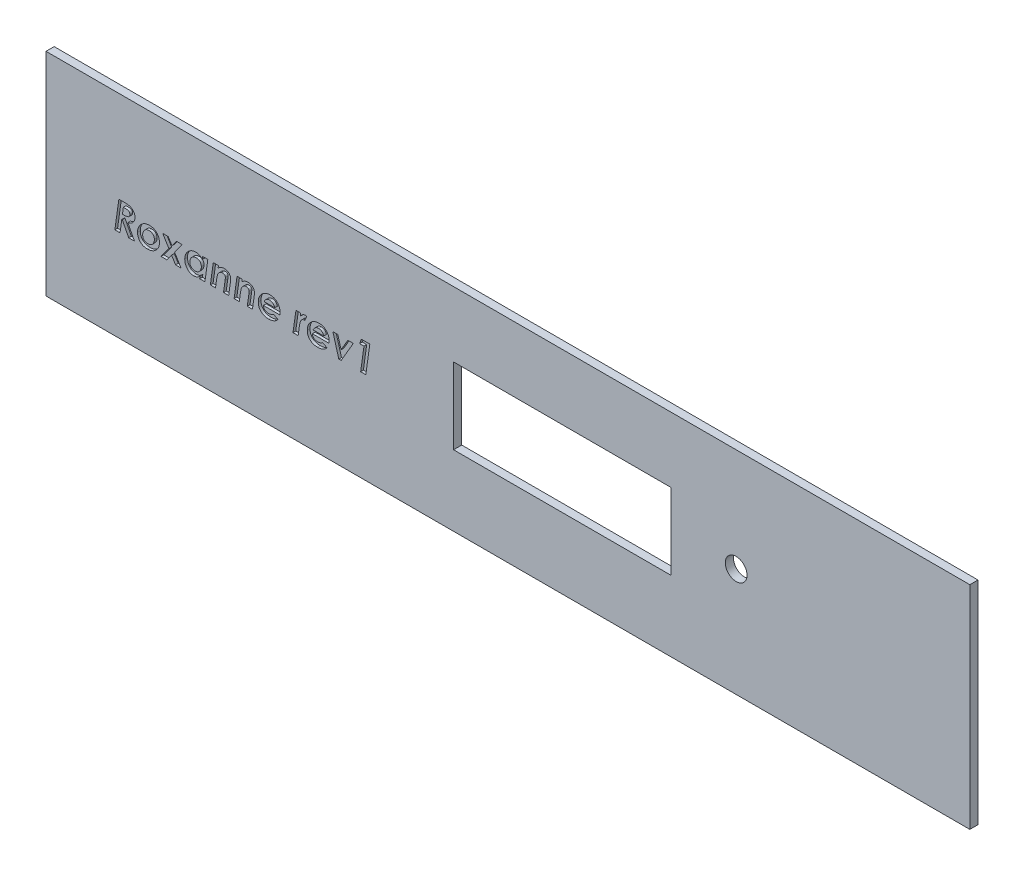
from build123d import *

# Parameters (mm, degrees)
ESQUISSE1_W             = 340
ESQUISSE1_H             = 78
BOSS_EXTRU_1_DEPTH      = 3
ENL_V_MAT_EXTRU_2_DEPTH = 1
ESQUISSE4_R             = 4
ESQUISSE4_W             = 80
ESQUISSE4_H             = 28
ENL_V_MAT_EXTRU_3_DEPTH = 175.441967547


with BuildPart() as part:
    # Esquisse1 → Boss.-Extru.1 (new body)
    with BuildSketch(Plane.XY):
        Rectangle(ESQUISSE1_W, ESQUISSE1_H)
    extrude(amount=BOSS_EXTRU_1_DEPTH)

    # Esquisse3 → Enlèv. mat.-Extru.2 (cut)
    # profile 1 of 11: a face of its own
    with BuildSketch(Plane.XY.offset(3)):
        with BuildLine():
            Line((-143.18360553, 5.280285758), (-141.359987741, 5.280285758))
            add(Edge.make_bspline(
                [(-141.359987741, 5.280285758), (-141.224655587, 5.279732714), (-140.963718923, 5.278666378), (-140.588483514, 5.263503099), (-140.244081244, 5.240626382), (-139.930921624, 5.210436022), (-139.648743197, 5.168548587), (-139.39813277, 5.118254331), (-139.177489639, 5.062244668), (-139.045170732, 5.010196837), (-138.983184857, 4.985814604)],
                knots=[0, 0, 0, 0, 1.348808202, 2.600664361, 3.742342956, 4.788858012, 5.735658768, 6.584006912, 7.336666444, 8, 8, 8, 8], degree=3))
            add(Edge.make_bspline(
                [(-138.983184857, 4.985814604), (-138.913396732, 4.954343493), (-138.776971993, 4.892822453), (-138.581483293, 4.788540514), (-138.398423342, 4.676200564), (-138.230826029, 4.551567019), (-138.075154533, 4.419887795), (-137.932374156, 4.27991045), (-137.803634581, 4.129486764), (-137.687584711, 3.971314785), (-137.58439367, 3.805599086), (-137.495814793, 3.631522477), (-137.419222171, 3.450558736), (-137.359409683, 3.260738661), (-137.309698315, 3.064340828), (-137.277546805, 2.860126101), (-137.254920089, 2.648783332), (-137.253060866, 2.505309215), (-137.252115145, 2.432329027)],
                knots=[0, 0, 0, 0, 1.116361014, 2.182309107, 3.229450697, 4.24598407, 5.225421932, 6.201651319, 7.158895679, 8.110002388, 9.060669178, 10.002827475, 10.956240434, 11.923213192, 12.902917952, 13.908279153, 14.936015885, 16, 16, 16, 16], degree=3))
            add(Edge.make_bspline(
                [(-137.252115145, 2.432329027), (-137.254339243, 2.342521883), (-137.258729972, 2.16522804), (-137.287419918, 1.903784419), (-137.340930232, 1.652902122), (-137.412992487, 1.411790847), (-137.502271834, 1.178889427), (-137.617409234, 0.958250518), (-137.75049375, 0.746029759), (-137.904192784, 0.5450095), (-138.07598846, 0.353345707), (-138.274352276, 0.182318009), (-138.488310465, 0.020424308), (-138.72665273, -0.121481136), (-138.982824071, -0.253298657), (-139.262667394, -0.364982473), (-139.560930477, -0.468049396), (-139.770067112, -0.519632956), (-139.877115145, -0.546036358)],
                knots=[0, 0, 0, 0, 0.995453645, 1.965186658, 2.910129054, 3.83459069, 4.752398018, 5.669942118, 6.588407184, 7.525617038, 8.471772905, 9.435289717, 10.423772802, 11.441988612, 12.505459691, 13.613754905, 14.778583949, 16, 16, 16, 16], degree=3))
            Line((-139.877115145, -0.546036358), (-137.454038222, -5.219714242))
            Line((-137.454038222, -5.219714242), (-139.559506972, -5.219714242))
            Line((-139.559506972, -5.219714242), (-141.932103126, -0.642791165))
            Line((-141.932103126, -0.642791165), (-142.110889184, -0.642791165))
            Line((-142.110889184, -0.642791165), (-142.754518991, -5.219714242))
            Line((-142.754518991, -5.219714242), (-144.655961299, -5.219714242))
            Line((-144.655961299, -5.219714242), (-143.18360553, 5.280285758))
        make_face()
        with BuildLine():
            add(Edge.make_bspline(
                [(-141.864795434, 1.107208835), (-141.729459211, 1.108465504), (-141.470595066, 1.110869196), (-141.100885896, 1.127588623), (-140.767493515, 1.153999243), (-140.47137943, 1.191741744), (-140.211764702, 1.236377465), (-139.989752185, 1.292101975), (-139.804324277, 1.358357402), (-139.652556306, 1.436929723), (-139.529613798, 1.529181293), (-139.423201774, 1.627628176), (-139.33459462, 1.737828565), (-139.261485776, 1.857932422), (-139.205099334, 1.988188689), (-139.164435992, 2.129479833), (-139.141952908, 2.280863782), (-139.138496615, 2.385283221), (-139.13673053, 2.438639123)],
                knots=[0, 0, 0, 0, 1.892208387, 3.619318591, 5.173427176, 6.566868293, 7.791773198, 8.8545744, 9.763297566, 10.539470204, 11.233547833, 11.906251103, 12.5615143, 13.203742025, 13.866659999, 14.539934446, 15.25394049, 16, 16, 16, 16], degree=3))
            add(Edge.make_bspline(
                [(-139.13673053, 2.438639123), (-139.139016658, 2.499137012), (-139.143451434, 2.616494624), (-139.181810435, 2.785523428), (-139.247403006, 2.938855511), (-139.339584426, 3.075024949), (-139.454621882, 3.195092419), (-139.594961274, 3.29398183), (-139.758998988, 3.371826823), (-139.912663197, 3.423256651), (-140.058114425, 3.453046124), (-140.193702995, 3.47306066), (-140.354236076, 3.492373974), (-140.540196541, 3.50665556), (-140.751360843, 3.516102563), (-140.987621471, 3.525282359), (-141.248501794, 3.528546747), (-141.430801515, 3.529688541), (-141.526153607, 3.530285758)],
                knots=[0, 0, 0, 0, 0.974340854, 1.890087692, 2.776057671, 3.647490651, 4.526730822, 5.442477659, 6.397820337, 7.445016909, 8.045730266, 8.789007992, 9.653967296, 10.651691253, 11.794598421, 13.061237498, 14.462876682, 16, 16, 16, 16], degree=3))
            Line((-141.526153607, 3.530285758), (-141.864795434, 1.107208835))
        make_face(mode=Mode.SUBTRACT)
    # profile 2 of 11: a face of its own
    with BuildSketch(Plane.XY.offset(3)):
        with BuildLine():
            add(Edge.make_bspline(
                [(-131.884326684, 2.587978065), (-131.799424296, 2.587195482), (-131.631391108, 2.585646646), (-131.38228626, 2.56022345), (-131.138357118, 2.525748631), (-130.900775398, 2.475336872), (-130.66975107, 2.409470777), (-130.44430611, 2.329236173), (-130.223883352, 2.235440947), (-130.011532567, 2.12538596), (-129.807440575, 2.003756871), (-129.613477722, 1.869615222), (-129.432874264, 1.721026436), (-129.260565884, 1.563786358), (-129.103811525, 1.39076428), (-128.958349948, 1.206885736), (-128.822422839, 1.012254695), (-128.699232084, 0.805672087), (-128.590746763, 0.588402819), (-128.49277852, 0.366022365), (-128.412731147, 0.135103632), (-128.348982744, -0.102150197), (-128.294065883, -0.34520142), (-128.260905523, -0.595152736), (-128.23508406, -0.851189781), (-128.233624584, -1.024130633), (-128.232884376, -1.111841646)],
                knots=[0, 0, 0, 0, 1.048380346, 2.074885017, 3.090367486, 4.090964834, 5.072523792, 6.056029873, 7.045505985, 8.029469653, 9.008388104, 9.979110116, 10.939576094, 11.895736256, 12.858269977, 13.820062943, 14.790784955, 15.789017664, 16.788414625, 17.789274365, 18.789121639, 19.804049856, 20.823403653, 21.864603227, 22.916983403, 24, 24, 24, 24], degree=3))
            add(Edge.make_bspline(
                [(-128.232884376, -1.111841646), (-128.23718252, -1.256460176), (-128.245648086, -1.541298868), (-128.305004328, -1.960318696), (-128.406448381, -2.362010406), (-128.548465447, -2.747536071), (-128.730127475, -3.116996391), (-128.952188571, -3.470722462), (-129.217240586, -3.805028485), (-129.516085384, -4.120689545), (-129.844008707, -4.409860524), (-130.195628193, -4.662799459), (-130.566429681, -4.876622764), (-130.955488694, -5.053039351), (-131.365641168, -5.187139972), (-131.793845842, -5.283186733), (-132.24082176, -5.344642916), (-132.545280345, -5.351059656), (-132.700432453, -5.354329627)],
                knots=[0, 0, 0, 0, 1.011104245, 1.991457176, 2.952197104, 3.902991464, 4.858928698, 5.826026836, 6.817568841, 7.837123857, 8.861887107, 9.870051414, 10.860623363, 11.850212162, 12.851715058, 13.872153699, 14.915649431, 16, 16, 16, 16], degree=3))
            add(Edge.make_bspline(
                [(-132.700432453, -5.354329627), (-132.834499501, -5.351862118), (-133.096463555, -5.347040661), (-133.478436129, -5.298932071), (-133.840188255, -5.224898759), (-134.180720648, -5.116248721), (-134.501389394, -4.980495871), (-134.800884768, -4.812307992), (-135.079969367, -4.614823493), (-135.33297425, -4.384525314), (-135.563287126, -4.132666316), (-135.762919062, -3.858639471), (-135.933658765, -3.566057373), (-136.069309328, -3.253296835), (-136.17739275, -2.923081285), (-136.254996946, -2.574530912), (-136.302272159, -2.206898841), (-136.307259756, -1.955435129), (-136.309807453, -1.826985877)],
                knots=[0, 0, 0, 0, 1.130534475, 2.209039425, 3.242686211, 4.241648197, 5.219495055, 6.175504508, 7.134035888, 8.097337106, 9.056251676, 10.008649417, 10.952170628, 11.908308165, 12.879116703, 13.879338768, 14.916752852, 16, 16, 16, 16], degree=3))
            add(Edge.make_bspline(
                [(-136.309807453, -1.826985877), (-136.305653143, -1.671853183), (-136.297480704, -1.366673073), (-136.236372391, -0.918738556), (-136.130506904, -0.491920766), (-135.984275181, -0.085456017), (-135.799606699, 0.30256986), (-135.567153477, 0.667235656), (-135.297450469, 1.014484362), (-134.987058437, 1.334746111), (-134.650968588, 1.626901847), (-134.298198258, 1.885340642), (-133.928364149, 2.100297196), (-133.547659629, 2.281844135), (-133.149676546, 2.417485655), (-132.740165524, 2.517087926), (-132.31664328, 2.577899178), (-132.029658555, 2.584589846), (-131.884326684, 2.587978065)],
                knots=[0, 0, 0, 0, 1.070407058, 2.105725986, 3.11260329, 4.099768105, 5.082273654, 6.071629737, 7.078227986, 8.111679688, 9.144009435, 10.148605521, 11.124500349, 12.092034995, 13.054511379, 14.020338642, 14.997480131, 16, 16, 16, 16], degree=3))
        make_face()
        with BuildLine():
            add(Edge.make_bspline(
                [(-132.023148799, 0.837978065), (-132.11723146, 0.835689933), (-132.300588612, 0.831230606), (-132.567134418, 0.792650658), (-132.816899094, 0.729801551), (-133.050820911, 0.641814014), (-133.265783517, 0.524421438), (-133.466518637, 0.38522868), (-133.647196888, 0.21734191), (-133.810003867, 0.02860714), (-133.953511229, -0.174914403), (-134.079629336, -0.384297742), (-134.186375507, -0.598698987), (-134.271232498, -0.8175758), (-134.342963321, -1.039496848), (-134.390624099, -1.26650027), (-134.418258584, -1.498176147), (-134.422864721, -1.653735048), (-134.425192068, -1.732334435)],
                knots=[0, 0, 0, 0, 1.147646984, 2.236642535, 3.278363253, 4.285788599, 5.277283386, 6.259990092, 7.25913394, 8.278119336, 9.296601724, 10.294389209, 11.258634566, 12.215104854, 13.156804447, 14.101569642, 15.040778374, 16, 16, 16, 16], degree=3))
            add(Edge.make_bspline(
                [(-134.425192068, -1.732334435), (-134.42344343, -1.801100593), (-134.420025192, -1.935524656), (-134.397214465, -2.132121093), (-134.356711492, -2.317737834), (-134.302737462, -2.493725108), (-134.230137949, -2.659138914), (-134.14253735, -2.814616279), (-134.037393555, -2.958623594), (-133.921128711, -3.093800872), (-133.787790124, -3.212928275), (-133.645075637, -3.318292455), (-133.491909883, -3.408460321), (-133.326696407, -3.478995878), (-133.151687582, -3.536587223), (-132.966206316, -3.575926086), (-132.770445967, -3.59934693), (-132.636697295, -3.602637523), (-132.567920434, -3.604329627)],
                knots=[0, 0, 0, 0, 1.110133544, 2.170088686, 3.189065258, 4.17351184, 5.136579884, 6.099647928, 7.048308506, 8.010844321, 8.972448026, 9.927769731, 10.871216919, 11.834284962, 12.822174017, 13.841150589, 14.889866456, 16, 16, 16, 16], degree=3))
            add(Edge.make_bspline(
                [(-132.567920434, -3.604329627), (-132.471058766, -3.601835138), (-132.282260578, -3.596972997), (-132.007991023, -3.561329456), (-131.751774841, -3.500802672), (-131.51368667, -3.414146569), (-131.29397621, -3.301576699), (-131.089941746, -3.167074641), (-130.906206442, -3.005029659), (-130.740762205, -2.82220472), (-130.59538988, -2.623653927), (-130.468480498, -2.415513498), (-130.358465615, -2.201762203), (-130.269704161, -1.979940846), (-130.202552894, -1.751550489), (-130.154012498, -1.51662091), (-130.123885119, -1.274579321), (-130.119641857, -1.11052531), (-130.117499761, -1.027707031)],
                knots=[0, 0, 0, 0, 1.164111062, 2.269030304, 3.317651816, 4.322802953, 5.30652745, 6.278887004, 7.252451034, 8.242831511, 9.237327035, 10.205734188, 11.170614506, 12.123681709, 13.072978069, 14.028315502, 15.004647829, 16, 16, 16, 16], degree=3))
            add(Edge.make_bspline(
                [(-130.117499761, -1.027707031), (-130.11907956, -0.960324798), (-130.122184835, -0.827877386), (-130.147662745, -0.634098734), (-130.190236046, -0.450640179), (-130.246233131, -0.275625388), (-130.323156634, -0.112345981), (-130.413025674, 0.043662363), (-130.524430288, 0.186173601), (-130.647559785, 0.320562261), (-130.783591075, 0.442729819), (-130.932389514, 0.548033747), (-131.089359821, 0.639335994), (-131.258060071, 0.710733805), (-131.435502813, 0.767464063), (-131.622462143, 0.810306833), (-131.819976837, 0.832703739), (-131.95438882, 0.836193062), (-132.023148799, 0.837978065)],
                knots=[0, 0, 0, 0, 1.079193067, 2.121276228, 3.123935011, 4.093589047, 5.058482656, 6.010079462, 6.971567708, 7.949254825, 8.927715837, 9.893916005, 10.864935156, 11.830939453, 12.821955205, 13.846519011, 14.898362312, 16, 16, 16, 16], degree=3))
        make_face(mode=Mode.SUBTRACT)
    # profile 3 of 11: a face of its own
    with BuildSketch(Plane.XY.offset(3)):
        Polygon((-127.046586299, 2.453362681), (-125.018942068, 2.453362681), (-123.658064664, 0.240622296), (-122.027956491, 2.453362681), (-119.88673053, 2.453362681), (-122.684206491, -1.345315204), (-120.303196876, -5.219714242), (-122.332944472, -5.219714242), (-123.790576684, -2.845014723), (-125.540576684, -5.219714242), (-127.681802645, -5.219714242), (-124.764434857, -1.261180588), align=None)
    # profile 4 of 11: a face of its own
    with BuildSketch(Plane.XY.offset(3)):
        with BuildLine():
            Line((-112.335648799, 2.453362681), (-110.434206491, 2.453362681))
            Line((-110.434206491, 2.453362681), (-111.523749761, -5.219714242))
            Line((-111.523749761, -5.219714242), (-113.425192068, -5.219714242))
            Line((-113.425192068, -5.219714242), (-113.292680049, -4.281613281))
            add(Edge.make_bspline(
                [(-113.292680049, -4.281613281), (-113.391549944, -4.37572398), (-113.580077294, -4.55517639), (-113.872072669, -4.787986291), (-114.153152411, -4.977325815), (-114.430265349, -5.122546783), (-114.711023, -5.227906941), (-115.002450313, -5.300882728), (-115.310473081, -5.346523043), (-115.521382516, -5.351683686), (-115.629518991, -5.354329627)],
                knots=[0, 0, 0, 0, 1.236324186, 2.357450916, 3.379388742, 4.30284698, 5.185433758, 6.089881904, 7.020653398, 8, 8, 8, 8], degree=3))
            add(Edge.make_bspline(
                [(-115.629518991, -5.354329627), (-115.753121458, -5.351450138), (-115.995190369, -5.345810811), (-116.348302095, -5.291238656), (-116.682118528, -5.205888972), (-116.996796868, -5.085457959), (-117.290636802, -4.928261271), (-117.566451539, -4.737701234), (-117.821746917, -4.511432029), (-118.053021662, -4.25244662), (-118.261596121, -3.97330981), (-118.443013841, -3.678343798), (-118.600542242, -3.374449876), (-118.723153755, -3.056076226), (-118.824368358, -2.729177072), (-118.89212519, -2.389392546), (-118.935833267, -2.03916224), (-118.94153749, -1.801878218), (-118.944422837, -1.681853665)],
                knots=[0, 0, 0, 0, 1.072254913, 2.099954687, 3.093402483, 4.05863531, 5.017013142, 5.979305845, 6.962352722, 7.970695896, 8.988290287, 9.983079422, 10.973839091, 11.95483031, 12.940586347, 13.940815436, 14.958409826, 16, 16, 16, 16], degree=3))
            add(Edge.make_bspline(
                [(-118.944422837, -1.681853665), (-118.94297508, -1.589238128), (-118.940095048, -1.40499745), (-118.911649867, -1.130181298), (-118.865301965, -0.859107437), (-118.801646915, -0.590876341), (-118.722301664, -0.325561554), (-118.623114652, -0.0641166), (-118.504137139, 0.192932093), (-118.37040087, 0.445892218), (-118.222784501, 0.691712844), (-118.057191986, 0.922436872), (-117.883364696, 1.142280938), (-117.69572687, 1.346934497), (-117.494751404, 1.535729447), (-117.284581212, 1.714619101), (-117.058448717, 1.874936722), (-116.824316735, 2.025055503), (-116.580825276, 2.155767779), (-116.334573148, 2.273231474), (-116.083658241, 2.368988742), (-115.831244811, 2.450047867), (-115.575132578, 2.51091946), (-115.316572064, 2.554674182), (-115.055259357, 2.583711822), (-114.880096032, 2.586554526), (-114.792379568, 2.587978065)],
                knots=[0, 0, 0, 0, 1.010861959, 2.01091412, 3.012605424, 4.011485121, 5.018863341, 6.033918867, 7.061452407, 8.109228878, 9.15680961, 10.18900835, 11.207521355, 12.215190347, 13.216881651, 14.216552911, 15.225616441, 16.240671966, 17.251099115, 18.240697123, 19.217272556, 20.180771028, 21.133199006, 22.08832996, 23.042693801, 24, 24, 24, 24], degree=3))
            add(Edge.make_bspline(
                [(-114.792379568, 2.587978065), (-114.675727844, 2.584654629), (-114.445790553, 2.578103658), (-114.109013759, 2.516693296), (-113.786387893, 2.419565961), (-113.47871156, 2.284875352), (-113.189765949, 2.113249718), (-112.927988774, 1.901842454), (-112.687465106, 1.659521047), (-112.555992929, 1.471811285), (-112.489194472, 1.376439604)],
                knots=[0, 0, 0, 0, 1.030509072, 2.031281277, 3.015697838, 4.003854478, 4.993584726, 5.977161716, 6.972235198, 8, 8, 8, 8], degree=3))
            Line((-112.489194472, 1.376439604), (-112.335648799, 2.453362681))
        make_face()
        with BuildLine():
            add(Edge.make_bspline(
                [(-115.206742549, -3.604329627), (-115.09709637, -3.600940622), (-114.883265861, -3.594331429), (-114.574338042, -3.535784683), (-114.286460304, -3.443588633), (-114.020067642, -3.311794182), (-113.774243939, -3.138457124), (-113.551107591, -2.922119436), (-113.349568342, -2.662961966), (-113.172821846, -2.368792627), (-113.025109527, -2.052416083), (-112.916883097, -1.7257926), (-112.847864189, -1.395191344), (-112.840115261, -1.172465955), (-112.836249761, -1.061360877)],
                knots=[0, 0, 0, 0, 1.017901168, 1.985097214, 2.910041334, 3.818973104, 4.735274743, 5.693545178, 6.695670165, 7.777101795, 8.875856117, 9.932619244, 10.968700869, 12, 12, 12, 12], degree=3))
            add(Edge.make_bspline(
                [(-112.836249761, -1.061360877), (-112.838018066, -0.99189294), (-112.841493174, -0.855373177), (-112.86420903, -0.656014284), (-112.904142036, -0.467162158), (-112.96143901, -0.288933468), (-113.034627289, -0.121136541), (-113.124249288, 0.036720541), (-113.229025285, 0.18353247), (-113.349457176, 0.319173847), (-113.484040152, 0.439346466), (-113.626735494, 0.549517666), (-113.784176997, 0.636029449), (-113.948733014, 0.711521482), (-114.124900323, 0.767206921), (-114.31028141, 0.810594474), (-114.507192734, 0.832647366), (-114.641593883, 0.836173984), (-114.710348318, 0.837978065)],
                knots=[0, 0, 0, 0, 1.109141645, 2.179707075, 3.198451464, 4.18615572, 5.163657463, 6.116161664, 7.079133258, 8.038519567, 9.005387219, 9.956904198, 10.909408399, 11.866440704, 12.843493655, 13.853714903, 14.902043453, 16, 16, 16, 16], degree=3))
            add(Edge.make_bspline(
                [(-114.710348318, 0.837978065), (-114.79041292, 0.836230408), (-114.948470829, 0.832780305), (-115.180735029, 0.797147382), (-115.404754494, 0.743943054), (-115.618360256, 0.664325181), (-115.823781047, 0.56619447), (-116.017822715, 0.442212881), (-116.204257868, 0.29855228), (-116.379128235, 0.133848774), (-116.538631801, -0.048390772), (-116.678231501, -0.244989034), (-116.797029321, -0.454824948), (-116.893829671, -0.677570395), (-116.967119381, -0.914179948), (-117.022265328, -1.161596176), (-117.054026946, -1.423014042), (-117.057849591, -1.601139277), (-117.059807453, -1.692370492)],
                knots=[0, 0, 0, 0, 0.994897251, 1.964056203, 2.915642991, 3.853470011, 4.79324038, 5.741466074, 6.711095529, 7.716481674, 8.723680824, 9.71796663, 10.70964959, 11.717112863, 12.731868792, 13.785363818, 14.865719672, 16, 16, 16, 16], degree=3))
            add(Edge.make_bspline(
                [(-117.059807453, -1.692370492), (-117.058007587, -1.762528871), (-117.0544878, -1.899729407), (-117.032354478, -2.100781367), (-116.989252041, -2.290491505), (-116.932653225, -2.470095354), (-116.861252306, -2.639765869), (-116.772320541, -2.798465806), (-116.666441048, -2.94649149), (-116.545138686, -3.082639766), (-116.410064665, -3.203843604), (-116.26692239, -3.312749622), (-116.112640066, -3.402919547), (-115.949323663, -3.477482755), (-115.77637509, -3.534142757), (-115.594407397, -3.573237249), (-115.403841025, -3.599976324), (-115.273444656, -3.602856381), (-115.206742549, -3.604329627)],
                knots=[0, 0, 0, 0, 1.124431694, 2.198919568, 3.234766021, 4.236791382, 5.213425507, 6.179206721, 7.145706547, 8.12447102, 9.094881178, 10.04988442, 11.001776355, 11.952075609, 12.922030374, 13.911569148, 14.931697721, 16, 16, 16, 16], degree=3))
        make_face(mode=Mode.SUBTRACT)
    # profile 5 of 11: a face of its own
    with BuildSketch(Plane.XY.offset(3)):
        with BuildLine():
            Line((-108.431802645, 2.453362681), (-106.530360337, 2.453362681))
            Line((-106.530360337, 2.453362681), (-106.650252164, 1.605706431))
            add(Edge.make_bspline(
                [(-106.650252164, 1.605706431), (-106.558824268, 1.683550068), (-106.380103794, 1.835716447), (-106.098907703, 2.035166171), (-105.817478581, 2.208486793), (-105.530048653, 2.344061733), (-105.241472251, 2.453927382), (-104.949715376, 2.531120214), (-104.654410764, 2.580069687), (-104.456629883, 2.585339176), (-104.357583895, 2.587978065)],
                knots=[0, 0, 0, 0, 1.129074261, 2.207080079, 3.239806547, 4.233987332, 5.191979582, 6.140686111, 7.068880775, 8, 8, 8, 8], degree=3))
            add(Edge.make_bspline(
                [(-104.357583895, 2.587978065), (-104.27479364, 2.58562421), (-104.112269808, 2.581003404), (-103.874012593, 2.554600419), (-103.648197931, 2.505573892), (-103.433406863, 2.438806859), (-103.231709041, 2.348808434), (-103.038278046, 2.244833692), (-102.859235426, 2.116505235), (-102.691520457, 1.972964813), (-102.541525306, 1.813140815), (-102.407044333, 1.644893269), (-102.295441424, 1.464286513), (-102.201889889, 1.27452027), (-102.130205933, 1.073330433), (-102.080029787, 0.862449937), (-102.050153051, 0.641817669), (-102.045999347, 0.49171655), (-102.043881972, 0.415201623)],
                knots=[0, 0, 0, 0, 1.118022855, 2.194767494, 3.230795032, 4.233728951, 5.225657328, 6.208555818, 7.193457995, 8.193528683, 9.184553253, 10.148487881, 11.096723343, 12.045053303, 13.000209424, 13.973718189, 14.967090947, 16, 16, 16, 16], degree=3))
            add(Edge.make_bspline(
                [(-102.043881972, 0.415201623), (-102.046150904, 0.332448051), (-102.051174608, 0.14922117), (-102.072515977, -0.15338459), (-102.114780674, -0.50922075), (-102.148074138, -0.764825488), (-102.165877164, -0.901505108)],
                knots=[0, 0, 0, 0, 0.750743129, 1.6622403, 2.749928862, 4, 4, 4, 4], degree=3))
            Line((-102.165877164, -0.901505108), (-102.773749761, -5.219714242))
            Line((-102.773749761, -5.219714242), (-104.675192068, -5.219714242))
            Line((-104.675192068, -5.219714242), (-104.079939664, -0.99615655))
            add(Edge.make_bspline(
                [(-104.079939664, -0.99615655), (-104.066955734, -0.900151289), (-104.042723365, -0.720973282), (-104.014349858, -0.471442833), (-103.999357743, -0.260151287), (-103.995457308, -0.132389412), (-103.993701684, -0.074882512)],
                knots=[0, 0, 0, 0, 1.255630561, 2.343427635, 3.254360171, 4, 4, 4, 4], degree=3))
            add(Edge.make_bspline(
                [(-103.993701684, -0.074882512), (-103.996693574, -0.005869895), (-104.002431604, 0.126486755), (-104.052577744, 0.313383096), (-104.141257671, 0.473894542), (-104.26383321, 0.606424756), (-104.417209511, 0.710977452), (-104.599262157, 0.7873034), (-104.811313069, 0.830626043), (-104.961746542, 0.835437529), (-105.041177645, 0.837978065)],
                knots=[0, 0, 0, 0, 1.048265012, 2.010427263, 2.912347805, 3.810226671, 4.72992967, 5.714049657, 6.792984344, 8, 8, 8, 8], degree=3))
            add(Edge.make_bspline(
                [(-105.041177645, 0.837978065), (-105.122804511, 0.8334372), (-105.28809224, 0.824242319), (-105.536063381, 0.763518252), (-105.780476806, 0.656908406), (-106.022668108, 0.517916126), (-106.252090115, 0.342616333), (-106.454300729, 0.129786338), (-106.630891844, -0.112055175), (-106.75311551, -0.341464049), (-106.838262901, -0.551638329), (-106.901398142, -0.742743284), (-106.960787064, -0.965837587), (-107.021998551, -1.219542135), (-107.080204953, -1.505298392), (-107.138967973, -1.8214556), (-107.196005944, -2.169962963), (-107.229901706, -2.413046494), (-107.247607934, -2.540026742)],
                knots=[0, 0, 0, 0, 0.882065441, 1.786110384, 2.740104157, 3.754965612, 4.797500545, 5.847687264, 6.91599857, 8.024311006, 8.646136181, 9.364850473, 10.197408591, 11.140054438, 12.184569392, 13.348033438, 14.614684545, 16, 16, 16, 16], degree=3))
            Line((-107.247607934, -2.540026742), (-107.619903607, -5.219714242))
            Line((-107.619903607, -5.219714242), (-109.521345914, -5.219714242))
            Line((-109.521345914, -5.219714242), (-108.431802645, 2.453362681))
        make_face()
    # profile 6 of 11: a face of its own
    with BuildSketch(Plane.XY.offset(3)):
        with BuildLine():
            Line((-99.681802645, 2.453362681), (-97.780360337, 2.453362681))
            Line((-97.780360337, 2.453362681), (-97.900252164, 1.605706431))
            add(Edge.make_bspline(
                [(-97.900252164, 1.605706431), (-97.808824268, 1.683550068), (-97.630103794, 1.835716447), (-97.348907703, 2.035166171), (-97.067478581, 2.208486793), (-96.780048653, 2.344061733), (-96.491472251, 2.453927382), (-96.199715376, 2.531120214), (-95.904410764, 2.580069687), (-95.706629883, 2.585339176), (-95.607583895, 2.587978065)],
                knots=[0, 0, 0, 0, 1.129074261, 2.207080079, 3.239806547, 4.233987332, 5.191979582, 6.140686111, 7.068880775, 8, 8, 8, 8], degree=3))
            add(Edge.make_bspline(
                [(-95.607583895, 2.587978065), (-95.52479364, 2.58562421), (-95.362269808, 2.581003404), (-95.124012593, 2.554600419), (-94.898197931, 2.505573892), (-94.683406863, 2.438806859), (-94.481709041, 2.348808434), (-94.288278046, 2.244833692), (-94.109235426, 2.116505235), (-93.941520457, 1.972964813), (-93.791525306, 1.813140815), (-93.657044333, 1.644893269), (-93.545441424, 1.464286513), (-93.451889889, 1.27452027), (-93.380205933, 1.073330433), (-93.330029787, 0.862449937), (-93.300153051, 0.641817669), (-93.295999347, 0.49171655), (-93.293881972, 0.415201623)],
                knots=[0, 0, 0, 0, 1.118022855, 2.194767494, 3.230795032, 4.233728951, 5.225657328, 6.208555818, 7.193457995, 8.193528683, 9.184553253, 10.148487881, 11.096723343, 12.045053303, 13.000209424, 13.973718189, 14.967090947, 16, 16, 16, 16], degree=3))
            add(Edge.make_bspline(
                [(-93.293881972, 0.415201623), (-93.296150904, 0.332448051), (-93.301174608, 0.14922117), (-93.322515977, -0.15338459), (-93.364780674, -0.50922075), (-93.398074138, -0.764825488), (-93.415877164, -0.901505108)],
                knots=[0, 0, 0, 0, 0.750743129, 1.6622403, 2.749928862, 4, 4, 4, 4], degree=3))
            Line((-93.415877164, -0.901505108), (-94.023749761, -5.219714242))
            Line((-94.023749761, -5.219714242), (-95.925192068, -5.219714242))
            Line((-95.925192068, -5.219714242), (-95.329939664, -0.99615655))
            add(Edge.make_bspline(
                [(-95.329939664, -0.99615655), (-95.316955734, -0.900151289), (-95.292723365, -0.720973282), (-95.264349858, -0.471442833), (-95.249357743, -0.260151287), (-95.245457308, -0.132389412), (-95.243701684, -0.074882512)],
                knots=[0, 0, 0, 0, 1.255630561, 2.343427635, 3.254360171, 4, 4, 4, 4], degree=3))
            add(Edge.make_bspline(
                [(-95.243701684, -0.074882512), (-95.246693574, -0.005869895), (-95.252431604, 0.126486755), (-95.302577744, 0.313383096), (-95.391257671, 0.473894542), (-95.51383321, 0.606424756), (-95.667209511, 0.710977452), (-95.849262157, 0.7873034), (-96.061313069, 0.830626043), (-96.211746542, 0.835437529), (-96.291177645, 0.837978065)],
                knots=[0, 0, 0, 0, 1.048265012, 2.010427263, 2.912347805, 3.810226671, 4.72992967, 5.714049657, 6.792984344, 8, 8, 8, 8], degree=3))
            add(Edge.make_bspline(
                [(-96.291177645, 0.837978065), (-96.372804511, 0.8334372), (-96.53809224, 0.824242319), (-96.786063381, 0.763518252), (-97.030476806, 0.656908406), (-97.272668108, 0.517916126), (-97.502090115, 0.342616333), (-97.704300729, 0.129786338), (-97.880891844, -0.112055175), (-98.00311551, -0.341464049), (-98.088262901, -0.551638329), (-98.151398142, -0.742743284), (-98.210787064, -0.965837587), (-98.271998551, -1.219542135), (-98.330204953, -1.505298392), (-98.388967973, -1.8214556), (-98.446005944, -2.169962963), (-98.479901706, -2.413046494), (-98.497607934, -2.540026742)],
                knots=[0, 0, 0, 0, 0.882065441, 1.786110384, 2.740104157, 3.754965612, 4.797500545, 5.847687264, 6.91599857, 8.024311006, 8.646136181, 9.364850473, 10.197408591, 11.140054438, 12.184569392, 13.348033438, 14.614684545, 16, 16, 16, 16], degree=3))
            Line((-98.497607934, -2.540026742), (-98.869903607, -5.219714242))
            Line((-98.869903607, -5.219714242), (-100.771345914, -5.219714242))
            Line((-100.771345914, -5.219714242), (-99.681802645, 2.453362681))
        make_face()
    # profile 7 of 11: a face of its own
    with BuildSketch(Plane.XY.offset(3)):
        with BuildLine():
            Line((-86.249711299, -2.950182992), (-84.602776203, -3.795735877))
            add(Edge.make_bspline(
                [(-84.602776203, -3.795735877), (-84.700070519, -3.912145961), (-84.89563258, -4.146130809), (-85.247194806, -4.449390985), (-85.640527534, -4.718209848), (-86.077005231, -4.945531249), (-86.548381095, -5.129658389), (-87.049249637, -5.257816756), (-87.574105926, -5.341812925), (-87.932771841, -5.35010665), (-88.115396395, -5.354329627)],
                knots=[0, 0, 0, 0, 0.914244933, 1.837636877, 2.790537697, 3.784087733, 4.800790172, 5.83726639, 6.89878507, 8, 8, 8, 8], degree=3))
            add(Edge.make_bspline(
                [(-88.115396395, -5.354329627), (-88.257872787, -5.351908011), (-88.535209497, -5.347194227), (-88.939514521, -5.298827964), (-89.321582692, -5.225182916), (-89.679472183, -5.116881202), (-90.016232493, -4.982730533), (-90.327709031, -4.813985827), (-90.615928885, -4.614049166), (-90.880918455, -4.388355459), (-91.11638305, -4.134519023), (-91.323985151, -3.861376757), (-91.497022777, -3.565450298), (-91.64140386, -3.251796863), (-91.749859104, -2.915991378), (-91.830577296, -2.562170222), (-91.876465145, -2.187158565), (-91.883254198, -1.930873032), (-91.88673053, -1.799642127)],
                knots=[0, 0, 0, 0, 1.167516698, 2.272623801, 3.333371772, 4.353538571, 5.333382306, 6.300396664, 7.250661637, 8.204535574, 9.148031545, 10.083792083, 11.011414416, 11.952824574, 12.908912643, 13.898953575, 14.92416002, 16, 16, 16, 16], degree=3))
            add(Edge.make_bspline(
                [(-91.88673053, -1.799642127), (-91.883619566, -1.648672591), (-91.877501107, -1.351754681), (-91.813566149, -0.916666478), (-91.715080324, -0.498802858), (-91.577041867, -0.098399887), (-91.394980365, 0.282752373), (-91.17911807, 0.64907268), (-90.917953191, 0.99399395), (-90.622819673, 1.318397163), (-90.300220037, 1.613921121), (-89.958166331, 1.875135355), (-89.597811994, 2.09535305), (-89.221820011, 2.276520676), (-88.828416252, 2.417219447), (-88.418506308, 2.51441848), (-87.992620983, 2.578628383), (-87.702672482, 2.584835856), (-87.555901203, 2.587978065)],
                knots=[0, 0, 0, 0, 1.05529311, 2.075487762, 3.068699193, 4.055083011, 5.031283693, 6.018666653, 7.023995929, 8.051577733, 9.082465902, 10.079966066, 11.057287041, 12.031169187, 12.994424047, 13.973330935, 14.974104677, 16, 16, 16, 16], degree=3))
            add(Edge.make_bspline(
                [(-87.555901203, 2.587978065), (-87.466831227, 2.586001206), (-87.291254898, 2.582104385), (-87.031094614, 2.561998011), (-86.779343513, 2.522770613), (-86.534206291, 2.473912879), (-86.297709699, 2.405547409), (-86.068558709, 2.322803019), (-85.844388085, 2.229655523), (-85.63074767, 2.116554229), (-85.423776934, 1.994275441), (-85.230137637, 1.853219381), (-85.044863399, 1.702938588), (-84.871186094, 1.53826521), (-84.711774411, 1.358295594), (-84.56126675, 1.166378613), (-84.423236762, 0.959771459), (-84.294900402, 0.742629169), (-84.182554213, 0.514705092), (-84.080342704, 0.283469364), (-83.999419436, 0.044810702), (-83.928041978, -0.196653041), (-83.877741606, -0.445427787), (-83.8352769, -0.69761766), (-83.815948039, -0.955191916), (-83.811863459, -1.127948254), (-83.809807453, -1.21490655)],
                knots=[0, 0, 0, 0, 1.072343926, 2.113823519, 3.137889586, 4.13760148, 5.120645553, 6.097657508, 7.069516392, 8.039614793, 9.005002879, 9.960565349, 10.920144366, 11.87525951, 12.837543921, 13.811635494, 14.808779264, 15.826321551, 16.845367656, 17.865985152, 18.866871901, 19.876579391, 20.894541571, 21.919893521, 22.952961626, 24, 24, 24, 24], degree=3))
            add(Edge.make_bspline(
                [(-83.809807453, -1.21490655), (-83.810706492, -1.272416461), (-83.812572306, -1.391769223), (-83.825689965, -1.578508004), (-83.849136195, -1.779072286), (-83.870364132, -1.917493003), (-83.881321876, -1.988945012)],
                knots=[0, 0, 0, 0, 0.886860648, 1.840539587, 2.885298471, 4, 4, 4, 4], degree=3))
            Line((-83.881321876, -1.988945012), (-90.002115145, -1.988945012))
            add(Edge.make_bspline(
                [(-90.002115145, -1.988945012), (-89.998098787, -2.049320039), (-89.990263797, -2.167097793), (-89.963813215, -2.338730229), (-89.918836103, -2.499893567), (-89.85950418, -2.651683802), (-89.787897403, -2.795840662), (-89.701889293, -2.931710149), (-89.59776698, -3.055131725), (-89.481472812, -3.169964071), (-89.351845445, -3.272538125), (-89.209451004, -3.360768756), (-89.056820392, -3.438413787), (-88.890176724, -3.497554532), (-88.713273033, -3.546943172), (-88.524388056, -3.579423841), (-88.324161987, -3.601610917), (-88.186275545, -3.603406583), (-88.115396395, -3.604329627)],
                knots=[0, 0, 0, 0, 1.040300458, 2.029386266, 2.980027991, 3.911437883, 4.828060054, 5.744444316, 6.66911896, 7.598419554, 8.551199615, 9.504589747, 10.47513087, 11.489753162, 12.539789264, 13.630032591, 14.781741895, 16, 16, 16, 16], degree=3))
            add(Edge.make_bspline(
                [(-88.115396395, -3.604329627), (-88.029094035, -3.602087518), (-87.858093127, -3.597644968), (-87.605028485, -3.568919814), (-87.359926886, -3.514886818), (-87.122156922, -3.443528572), (-86.890799173, -3.353829207), (-86.670100793, -3.237885273), (-86.453535501, -3.106253686), (-86.31823141, -3.002649682), (-86.249711299, -2.950182992)],
                knots=[0, 0, 0, 0, 1.027214308, 2.035339218, 3.025519259, 4.010199041, 4.987959988, 5.973205312, 6.973599434, 8, 8, 8, 8], degree=3))
        make_face()
        with BuildLine():
            add(Edge.make_bspline(
                [(-85.829038222, -0.642791165), (-85.866439428, -0.527229175), (-85.938456045, -0.304712724), (-86.095548802, -0.002638568), (-86.28731123, 0.255458348), (-86.513979173, 0.467725587), (-86.771212476, 0.633038575), (-87.054109248, 0.7526023), (-87.362866798, 0.826253841), (-87.577919812, 0.833998757), (-87.688413222, 0.837978065)],
                knots=[0, 0, 0, 0, 1.131480038, 2.178682812, 3.159669316, 4.117470342, 5.058967564, 5.99670948, 6.970717055, 8, 8, 8, 8], degree=3))
            add(Edge.make_bspline(
                [(-87.688413222, 0.837978065), (-87.798953342, 0.834096053), (-88.016992852, 0.826438813), (-88.333781319, 0.748419352), (-88.63556755, 0.628240828), (-88.91582421, 0.456322344), (-89.175224888, 0.244329154), (-89.397872678, -0.014642013), (-89.594091223, -0.309343509), (-89.689924041, -0.529567583), (-89.739194472, -0.642791165)],
                knots=[0, 0, 0, 0, 0.983432494, 1.939812791, 2.890131691, 3.868528921, 4.858194814, 5.863362488, 6.901492691, 8, 8, 8, 8], degree=3))
            Line((-89.739194472, -0.642791165), (-85.829038222, -0.642791165))
        make_face(mode=Mode.SUBTRACT)
    # profile 8 of 11: a face of its own
    with BuildSketch(Plane.XY.offset(3)):
        with BuildLine():
            Line((-78.008725722, 2.453362681), (-76.241898799, 2.453362681))
            Line((-76.241898799, 2.453362681), (-76.378617549, 1.376439604))
            add(Edge.make_bspline(
                [(-76.378617549, 1.376439604), (-76.315124968, 1.472317386), (-76.192769167, 1.657082324), (-75.987708375, 1.90517162), (-75.772757866, 2.114889532), (-75.54844355, 2.288166023), (-75.313337241, 2.422102513), (-75.068440954, 2.518158898), (-74.813709083, 2.577236632), (-74.640144181, 2.584384811), (-74.552896395, 2.587978065)],
                knots=[0, 0, 0, 0, 1.203274242, 2.318815539, 3.362160423, 4.341361458, 5.27818761, 6.184615762, 7.087440759, 8, 8, 8, 8], degree=3))
            add(Edge.make_bspline(
                [(-74.552896395, 2.587978065), (-74.51000981, 2.586281597), (-74.422130812, 2.582805359), (-74.289496235, 2.556040137), (-74.153878324, 2.514262366), (-74.065914578, 2.474024788), (-74.020744953, 2.453362681)],
                knots=[0, 0, 0, 0, 0.929430428, 1.904497954, 2.92395396, 4, 4, 4, 4], degree=3))
            Line((-74.020744953, 2.453362681), (-74.765336299, 0.745429988))
            add(Edge.make_bspline(
                [(-74.765336299, 0.745429988), (-74.79958626, 0.759024235), (-74.862688244, 0.784070217), (-74.95130035, 0.814817513), (-75.026198397, 0.832366325), (-75.07166979, 0.836282462), (-75.091357934, 0.837978065)],
                knots=[0, 0, 0, 0, 1.298729578, 2.392773935, 3.304105365, 4, 4, 4, 4], degree=3))
            add(Edge.make_bspline(
                [(-75.091357934, 0.837978065), (-75.1385014, 0.835901453), (-75.231614453, 0.831799937), (-75.36882215, 0.800449645), (-75.502760187, 0.751834628), (-75.633576481, 0.682438168), (-75.758074363, 0.589388223), (-75.880366058, 0.48003078), (-75.998663971, 0.350373715), (-76.11406964, 0.198592465), (-76.226036147, 0.017089293), (-76.324631598, -0.204715285), (-76.420772845, -0.464121425), (-76.513904375, -0.763506051), (-76.595437847, -1.10494358), (-76.675771507, -1.485604259), (-76.749016534, -1.90659597), (-76.790352328, -2.201253392), (-76.811910818, -2.354930588)],
                knots=[0, 0, 0, 0, 0.576935763, 1.139505725, 1.715418098, 2.31853603, 2.945453378, 3.61436612, 4.325438415, 5.091425351, 5.947081821, 6.930670679, 8.058330957, 9.334895625, 10.767784451, 12.355934311, 14.099454639, 16, 16, 16, 16], degree=3))
            Line((-76.811910818, -2.354930588), (-77.196826684, -5.219714242))
            Line((-77.196826684, -5.219714242), (-79.098268991, -5.219714242))
            Line((-79.098268991, -5.219714242), (-78.008725722, 2.453362681))
        make_face()
    # profile 9 of 11: a face of its own
    with BuildSketch(Plane.XY.offset(3)):
        with BuildLine():
            Line((-68.211249761, -2.950182992), (-66.564314664, -3.795735877))
            add(Edge.make_bspline(
                [(-66.564314664, -3.795735877), (-66.66160898, -3.912145961), (-66.857171041, -4.146130809), (-67.208733267, -4.449390985), (-67.602065995, -4.718209848), (-68.038543692, -4.945531249), (-68.509919556, -5.129658389), (-69.010788099, -5.257816756), (-69.535644388, -5.341812925), (-69.894310303, -5.35010665), (-70.076934857, -5.354329627)],
                knots=[0, 0, 0, 0, 0.914244933, 1.837636877, 2.790537697, 3.784087733, 4.800790172, 5.83726639, 6.89878507, 8, 8, 8, 8], degree=3))
            add(Edge.make_bspline(
                [(-70.076934857, -5.354329627), (-70.219411249, -5.351908011), (-70.496747959, -5.347194227), (-70.901052982, -5.298827964), (-71.283121154, -5.225182916), (-71.641010645, -5.116881202), (-71.977770955, -4.982730533), (-72.289247492, -4.813985827), (-72.577467346, -4.614049166), (-72.842456917, -4.388355459), (-73.077921512, -4.134519023), (-73.285523612, -3.861376757), (-73.458561238, -3.565450298), (-73.602942321, -3.251796863), (-73.711397565, -2.915991378), (-73.792115757, -2.562170222), (-73.838003606, -2.187158565), (-73.844792659, -1.930873032), (-73.848268991, -1.799642127)],
                knots=[0, 0, 0, 0, 1.167516698, 2.272623801, 3.333371772, 4.353538571, 5.333382306, 6.300396664, 7.250661637, 8.204535574, 9.148031545, 10.083792083, 11.011414416, 11.952824574, 12.908912643, 13.898953575, 14.92416002, 16, 16, 16, 16], degree=3))
            add(Edge.make_bspline(
                [(-73.848268991, -1.799642127), (-73.845158028, -1.648672591), (-73.839039569, -1.351754681), (-73.775104611, -0.916666478), (-73.676618785, -0.498802858), (-73.538580329, -0.098399887), (-73.356518827, 0.282752373), (-73.140656531, 0.64907268), (-72.879491652, 0.99399395), (-72.584358135, 1.318397163), (-72.261758499, 1.613921121), (-71.919704792, 1.875135355), (-71.559350456, 2.09535305), (-71.183358473, 2.276520676), (-70.789954714, 2.417219447), (-70.38004477, 2.51441848), (-69.954159444, 2.578628383), (-69.664210943, 2.584835856), (-69.517439664, 2.587978065)],
                knots=[0, 0, 0, 0, 1.05529311, 2.075487762, 3.068699193, 4.055083011, 5.031283693, 6.018666653, 7.023995929, 8.051577733, 9.082465902, 10.079966066, 11.057287041, 12.031169187, 12.994424047, 13.973330935, 14.974104677, 16, 16, 16, 16], degree=3))
            add(Edge.make_bspline(
                [(-69.517439664, 2.587978065), (-69.428369688, 2.586001206), (-69.252793359, 2.582104385), (-68.992633075, 2.561998011), (-68.740881975, 2.522770613), (-68.495744752, 2.473912879), (-68.25924816, 2.405547409), (-68.03009717, 2.322803019), (-67.805926547, 2.229655523), (-67.592286131, 2.116554229), (-67.385315395, 1.994275441), (-67.191676098, 1.853219381), (-67.00640186, 1.702938588), (-66.832724556, 1.53826521), (-66.673312873, 1.358295594), (-66.522805212, 1.166378613), (-66.384775223, 0.959771459), (-66.256438863, 0.742629169), (-66.144092674, 0.514705092), (-66.041881166, 0.283469364), (-65.960957898, 0.044810702), (-65.889580439, -0.196653041), (-65.839280068, -0.445427787), (-65.796815362, -0.69761766), (-65.777486501, -0.955191916), (-65.773401921, -1.127948254), (-65.771345914, -1.21490655)],
                knots=[0, 0, 0, 0, 1.072343926, 2.113823519, 3.137889586, 4.13760148, 5.120645553, 6.097657508, 7.069516392, 8.039614793, 9.005002879, 9.960565349, 10.920144366, 11.87525951, 12.837543921, 13.811635494, 14.808779264, 15.826321551, 16.845367656, 17.865985152, 18.866871901, 19.876579391, 20.894541571, 21.919893521, 22.952961626, 24, 24, 24, 24], degree=3))
            add(Edge.make_bspline(
                [(-65.771345914, -1.21490655), (-65.772244953, -1.272416461), (-65.774110767, -1.391769223), (-65.787228426, -1.578508004), (-65.810674656, -1.779072286), (-65.831902594, -1.917493003), (-65.842860337, -1.988945012)],
                knots=[0, 0, 0, 0, 0.886860648, 1.840539587, 2.885298471, 4, 4, 4, 4], degree=3))
            Line((-65.842860337, -1.988945012), (-71.963653607, -1.988945012))
            add(Edge.make_bspline(
                [(-71.963653607, -1.988945012), (-71.959637248, -2.049320039), (-71.951802259, -2.167097793), (-71.925351676, -2.338730229), (-71.880374565, -2.499893567), (-71.821042642, -2.651683802), (-71.749435864, -2.795840662), (-71.663427754, -2.931710149), (-71.559305441, -3.055131725), (-71.443011274, -3.169964071), (-71.313383906, -3.272538125), (-71.170989465, -3.360768756), (-71.018358854, -3.438413787), (-70.851715185, -3.497554532), (-70.674811494, -3.546943172), (-70.485926517, -3.579423841), (-70.285700449, -3.601610917), (-70.147814007, -3.603406583), (-70.076934857, -3.604329627)],
                knots=[0, 0, 0, 0, 1.040300458, 2.029386266, 2.980027991, 3.911437883, 4.828060054, 5.744444316, 6.66911896, 7.598419554, 8.551199615, 9.504589747, 10.47513087, 11.489753162, 12.539789264, 13.630032591, 14.781741895, 16, 16, 16, 16], degree=3))
            add(Edge.make_bspline(
                [(-70.076934857, -3.604329627), (-69.990632496, -3.602087518), (-69.819631589, -3.597644968), (-69.566566947, -3.568919814), (-69.321465348, -3.514886818), (-69.083695384, -3.443528572), (-68.852337634, -3.353829207), (-68.631639255, -3.237885273), (-68.415073963, -3.106253686), (-68.279769871, -3.002649682), (-68.211249761, -2.950182992)],
                knots=[0, 0, 0, 0, 1.027214308, 2.035339218, 3.025519259, 4.010199041, 4.987959988, 5.973205312, 6.973599434, 8, 8, 8, 8], degree=3))
        make_face()
        with BuildLine():
            add(Edge.make_bspline(
                [(-67.790576684, -0.642791165), (-67.827977889, -0.527229175), (-67.899994506, -0.304712724), (-68.057087264, -0.002638568), (-68.248849691, 0.255458348), (-68.475517635, 0.467725587), (-68.732750938, 0.633038575), (-69.01564771, 0.7526023), (-69.324405259, 0.826253841), (-69.539458274, 0.833998757), (-69.649951684, 0.837978065)],
                knots=[0, 0, 0, 0, 1.131480038, 2.178682812, 3.159669316, 4.117470342, 5.058967564, 5.99670948, 6.970717055, 8, 8, 8, 8], degree=3))
            add(Edge.make_bspline(
                [(-69.649951684, 0.837978065), (-69.760491804, 0.834096053), (-69.978531314, 0.826438813), (-70.29531978, 0.748419352), (-70.597106012, 0.628240828), (-70.877362671, 0.456322344), (-71.13676335, 0.244329154), (-71.359411139, -0.014642013), (-71.555629685, -0.309343509), (-71.651462503, -0.529567583), (-71.700732934, -0.642791165)],
                knots=[0, 0, 0, 0, 0.983432494, 1.939812791, 2.890131691, 3.868528921, 4.858194814, 5.863362488, 6.901492691, 8, 8, 8, 8], degree=3))
            Line((-71.700732934, -0.642791165), (-67.790576684, -0.642791165))
        make_face(mode=Mode.SUBTRACT)
    # profile 10 of 11: a face of its own
    with BuildSketch(Plane.XY.offset(3)):
        Polygon((-64.429398799, 2.453362681), (-62.614194472, 2.453362681), (-61.396345914, -1.814365685), (-58.897547837, 2.453362681), (-56.893040626, 2.453362681), (-61.383725722, -5.219714242), (-62.239795434, -5.219714242), align=None)
    # profile 11 of 11: a face of its own
    with BuildSketch(Plane.XY.offset(3)):
        Polygon((-53.950432453, 5.280285758), (-50.833244953, 5.280285758), (-52.29298053, -5.219714242), (-54.194422837, -5.219714242), (-52.978677645, 3.530285758), (-54.577235337, 3.530285758), align=None)
    extrude(amount=-ENL_V_MAT_EXTRU_2_DEPTH, mode=Mode.SUBTRACT)

    # Esquisse4 → Enlèv. mat.-Extru.3 (cut, through all)
    with BuildSketch(Plane.XY.offset(3)):
        with Locations((84, 1)):
            Circle(ESQUISSE4_R)
        with Locations((20, 1)):
            Rectangle(ESQUISSE4_W, ESQUISSE4_H)
    extrude(amount=-ENL_V_MAT_EXTRU_3_DEPTH, mode=Mode.SUBTRACT)


solid = part.part
